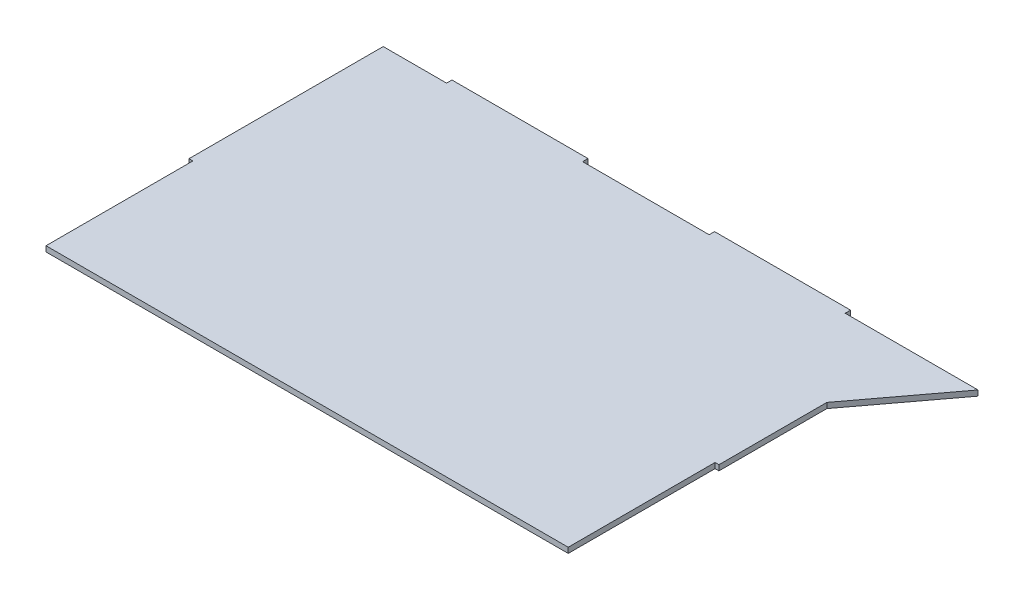
from build123d import *

# Parameters (mm, degrees)
SKETCH1_W           = 311.675852644
SKETCH1_H           = 3.175
BOSS_EXTRUDE1_DEPTH = 200.60000012
CUT_EXTRUDE2_START  = -3.175
SKETCH5_W           = 2.286
SKETCH5_H           = 86.36
CUT_EXTRUDE2_DEPTH  = 258.214170117
SKETCH3_W           = 80
SKETCH3_H           = 3.175
BOSS_EXTRUDE2_DEPTH = 3.175
LPATTERN2_COUNT     = 2
LPATTERN2_PITCH     = 154.43
BOSS_EXTRUDE3_DEPTH = 3.175


with BuildPart() as part:
    # Sketch1 → Boss-Extrude1 (new body)
    with BuildSketch(Plane.XY):
        Rectangle(SKETCH1_W, SKETCH1_H)
    extrude(amount=BOSS_EXTRUDE1_DEPTH)

    # Sketch5 → Cut-Extrude2 (cut)
    with BuildSketch(Plane(origin=(0, 1.5875, 0), x_dir=(1, 0, 0), z_dir=(0, 1, 0)).offset(CUT_EXTRUDE2_START)):
        with Locations((-154.694926322, -157.42000012)):
            Rectangle(SKETCH5_W, SKETCH5_H)
    cut_extrude2 = extrude(amount=CUT_EXTRUDE2_DEPTH, mode=Mode.SUBTRACT)

    # Mirror1: Cut-Extrude2 across plane
    add(cut_extrude2.mirror(Plane(origin=(0, 0, 0), x_dir=(0, 0, 1), z_dir=(1, 0, 0))), mode=Mode.SUBTRACT)

    # Sketch3 → Boss-Extrude2 (add)
    with BuildSketch(Plane(origin=(0, 0, 0), x_dir=(-1, 0, 0), z_dir=(0, 0, -1))):
        with Locations((-75.837926322, 0)):
            Rectangle(SKETCH3_W, SKETCH3_H)
    boss_extrude2 = extrude(amount=BOSS_EXTRUDE2_DEPTH)

    # LPattern2: Boss-Extrude2 ×2
    with Locations(*[(-i * LPATTERN2_PITCH, 0, 0) for i in range(1, LPATTERN2_COUNT)]):
        add(boss_extrude2)

    # Sketch10 → Boss-Extrude3 (add)
    with BuildSketch(Plane.XZ.offset(1.5875)):
        Polygon((155.837926322, 0), (193.937926322, 0), (155.837926322, 50.8), align=None)
    extrude(amount=-BOSS_EXTRUDE3_DEPTH)


solid = part.part
